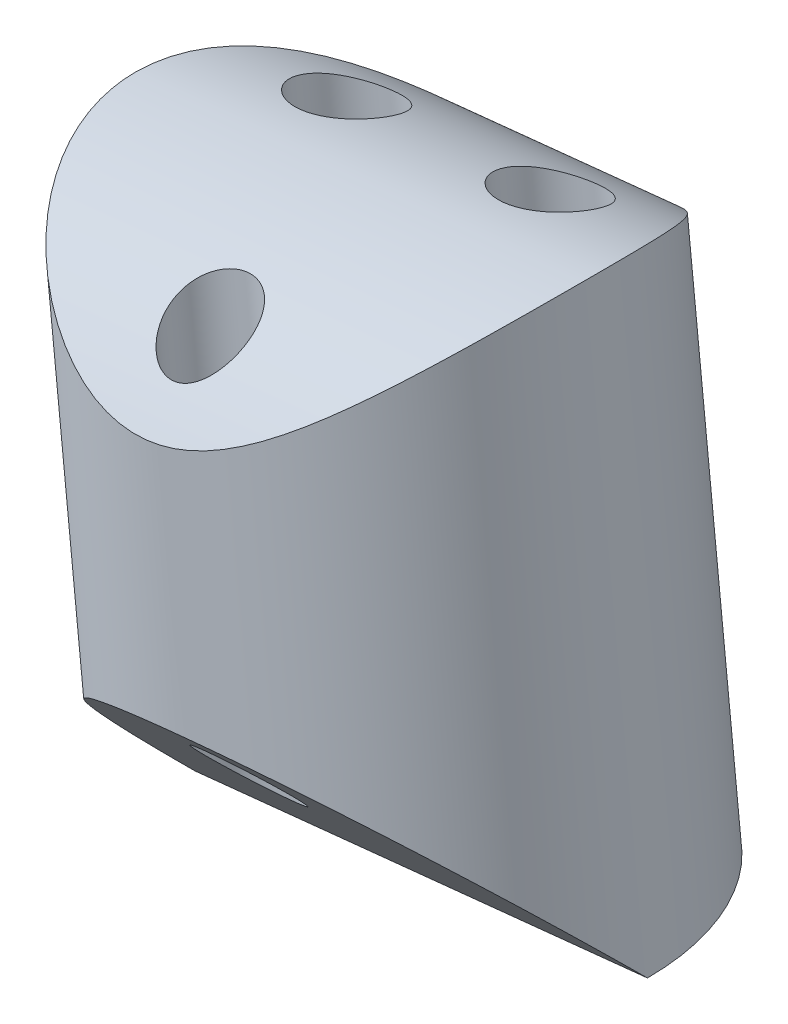
from build123d import *

# Parameters (mm, degrees)
SKETCH3_R               = 8
BOSS_EXTRUDE1_DEPTH     = 20.490526316
CUT_EXTRUDE1_DEPTH      = 220.648426525
CUT_EXTRUDE1_DEPTH_BACK = 220.648426525
CUT_EXTRUDE2_DEPTH      = 220.520875901
CUT_EXTRUDE2_DEPTH_BACK = 220.520875901
CUT_EXTRUDE3_DEPTH      = 25.801942762
CUT_EXTRUDE3_DEPTH_BACK = 25.801942762
SKETCH8_R               = 1.6
SKETCH8_R_2             = 1.4


with BuildPart() as part:
    # Sketch3 → Boss-Extrude1 (new body)
    with BuildSketch(Plane(origin=(-12.082314344, 217.636022384, 0), x_dir=(-0.9946657577296572, -0.10315052302381673, 0), z_dir=(0.10315052302381673, -0.9946657577296572, 0))):
        Circle(SKETCH3_R)
    extrude(amount=BOSS_EXTRUDE1_DEPTH)

    # Sketch4 → Cut-Extrude1 (cut, two sides: drawn at the far end of the back side and taken through both)
    with BuildSketch(Plane(origin=(10.375761543, 1.076004901, 0), x_dir=(0.10315052302381672, -0.9946657577296572, 0), z_dir=(-0.9946657577296572, -0.10315052302381673, 0)).offset(-CUT_EXTRUDE1_DEPTH_BACK)):
        with BuildLine():
            Line((-217.721396158, 8), (-213.721396158, 8))
            ThreePointArc((-213.721396158, 8), (-217.59367935, 0), (-213.721396158, -8))
            Line((-213.721396158, -8), (-217.721396158, -8))
            Line((-217.721396158, -8), (-217.721396158, 8))
        make_face()
    extrude(amount=CUT_EXTRUDE1_DEPTH + CUT_EXTRUDE1_DEPTH_BACK, mode=Mode.SUBTRACT)

    # Sketch5 → Cut-Extrude2 (cut, two sides: drawn at the far end of the back side and taken through both)
    with BuildSketch(Plane(origin=(10.375761543, 1.076004901, 0), x_dir=(0.10315052302381672, -0.9946657577296572, 0), z_dir=(-0.9946657577296572, -0.10315052302381673, 0)).offset(-CUT_EXTRUDE2_DEPTH_BACK)):
        Polygon((-197.230869842, 0), (-205.230869842, 8), (-197.230869842, 8), align=None)
    extrude(amount=CUT_EXTRUDE2_DEPTH + CUT_EXTRUDE2_DEPTH_BACK, mode=Mode.SUBTRACT)

    # Sketch8 → Cut-Extrude3 (cut, two sides: drawn at the far end of the back side and taken through both)
    with BuildSketch(Plane(origin=(-12.082314344, 217.636022384, 0), x_dir=(-0.9946657577296572, -0.10315052302381673, 0), z_dir=(0.10315052302381673, -0.9946657577296572, 0)).offset(-CUT_EXTRUDE3_DEPTH_BACK)):
        with Locations((-3.6, 3)):
            Circle(SKETCH8_R)
        with Locations((3.6, 3)):
            Circle(SKETCH8_R)
        with Locations((0, -5.5)):
            Circle(SKETCH8_R_2)
    extrude(amount=CUT_EXTRUDE3_DEPTH + CUT_EXTRUDE3_DEPTH_BACK, mode=Mode.SUBTRACT)


solid = part.part
